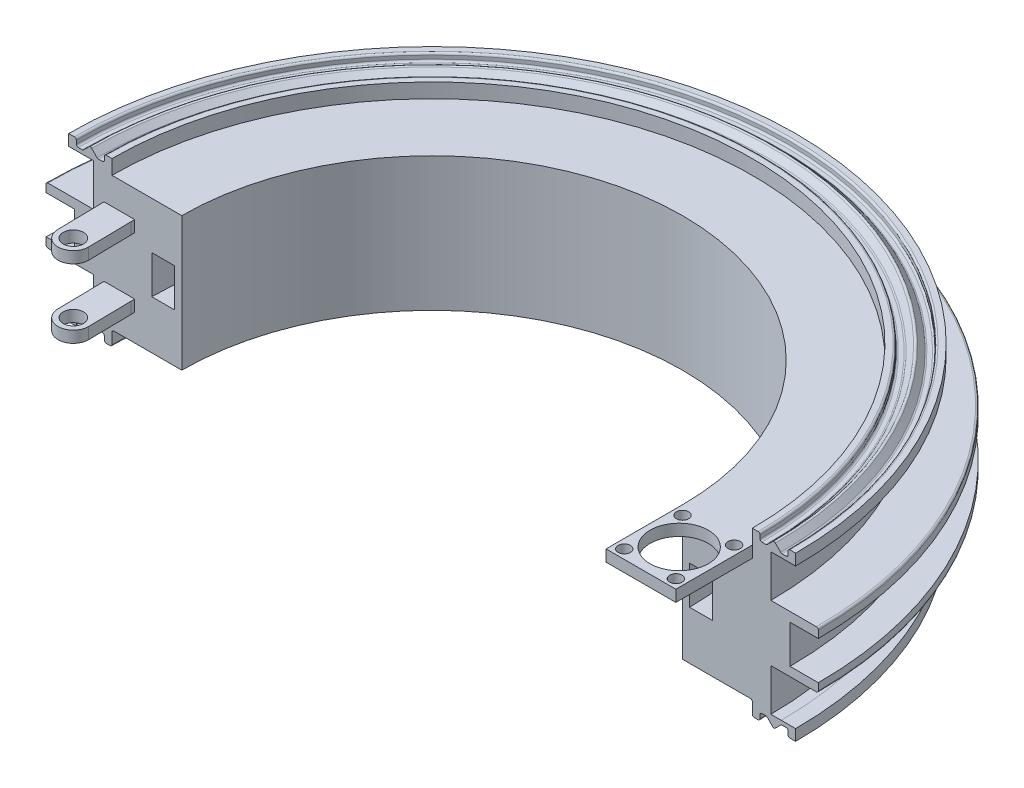
from build123d import *

# Parameters (mm, degrees)
SKETCH1_W           = 6
SKETCH1_H           = 10
SKETCH17_W          = 18.25
SKETCH17_H          = 3
BOSS_EXTRUDE5_DEPTH = 20
FILLET1_R           = 0.5
FILLET2_R           = 0.5
FILLET3_R           = 0.5
FILLET4_R           = 0.5
FILLET5_R           = 0.5
FILLET6_R           = 0.5
FILLET7_R           = 0.5
FILLET9_R           = 0.5
FILLET10_R          = 0.5
SKETCH13_W          = 8
SKETCH13_H          = 3
BOSS_EXTRUDE6_DEPTH = 1
SKETCH19_R          = 2.65
BOSS_EXTRUDE7_DEPTH = 3
SKETCH20_R          = 7.61273287
SKETCH20_R_2        = 1.605194104
CUT_EXTRUDE2_DEPTH  = 13


with BuildPart() as part:
    # Sweep3: sweep along a path in Sketch3
    with BuildLine(Plane(origin=(0, 0, 0), x_dir=(1, 0, 0), z_dir=(0, 1, 0))) as sweep3_path:
        ThreePointArc((0, 0), (65.459977148, 65.459977148), (130.919954296, 0))
    # Sketch1 → Sweep3 (sweep)
    with BuildSketch(Plane.XY):
        Polygon((0, 21.243112223), (0, -13.756887777), (-18.25, -13.756887777), (-18.25, -17.565543398), (-20.25, -17.565543398), (-20.25, -15.656355089), (-22, -15.656355089), (-23.909188309, -17.565543398), (-25.818376618, -15.656355089), (-27.568376618, -15.656355089), (-27.568376618, -17.565543398), (-29.568376618, -17.565543398), (-29.568376618, -14.656355089), (-25.818376618, -14.656355089), (-23.090911996, -14.656355089), (-23.090911996, -3.637682855), (-35.498482324, -3.637682855), (-35.498482324, -1.30053875), (-28.102361975, -1.30053875), (-28.102361975, 8.69946125), (-35.498482324, 8.69946125), (-35.498482324, 11.1239073), (-23.090911996, 11.1239073), (-23.090911996, 22.142579535), (-25.818376618, 22.142579535), (-29.568376618, 22.142579535), (-29.568376618, 25.051767844), (-27.568376618, 25.051767844), (-27.568376618, 23.142579535), (-25.818376618, 23.142579535), (-23.909188309, 25.051767844), (-22, 23.142579535), (-20.25, 23.142579535), (-20.25, 25.051767844), (-18.25, 25.051767844), (-18.25, 21.243112223), align=None)
        with Locations((-4.842428612, 3.950784343)):
            Rectangle(SKETCH1_W, SKETCH1_H, mode=Mode.SUBTRACT)
    sweep(path=sweep3_path.line)

    # Sketch17 → Boss-Extrude5 (add)
    with BuildSketch(Plane.XY):
        with Locations((140.044954296, 19.743112223)):
            Rectangle(SKETCH17_W, SKETCH17_H)
    extrude(amount=BOSS_EXTRUDE5_DEPTH)

    # Fillet1
    fillet1_edges = [part.edges().sort_by_distance(p)[0] for p in [
        (65.459977148, 25.051767844, -89.369165457),
    ]]
    fillet(fillet1_edges, radius=FILLET1_R)

    # Fillet2
    fillet2_edges = [part.edges().sort_by_distance(p)[0] for p in [
        (65.459977148, 23.142579535, -91.278353766),
    ]]
    fillet(fillet2_edges, radius=FILLET2_R)

    # Fillet3
    fillet3_edges = [part.edges().sort_by_distance(p)[0] for p in [
        (65.459977148, 23.142579535, -93.028353766),
    ]]
    fillet(fillet3_edges, radius=FILLET3_R)

    # Fillet4
    fillet4_edges = [part.edges().sort_by_distance(p)[0] for p in [
        (65.459977148, 23.142579535, -85.709977148),
        (65.459977148, 23.142579535, -87.459977148),
    ]]
    fillet(fillet4_edges, radius=FILLET4_R)

    # Fillet5
    fillet5_edges = [part.edges().sort_by_distance(p)[0] for p in [
        (65.459977148, -17.565543398, -85.709977148),
        (65.459977148, -15.656355089, -87.459977148),
        (65.459977148, -17.565543398, -89.369165457),
    ]]
    fillet(fillet5_edges, radius=FILLET5_R)

    # Fillet6
    fillet6_edges = [part.edges().sort_by_distance(p)[0] for p in [
        (65.459977148, -13.756887777, -83.709977148),
        (65.459977148, -17.565543398, -83.709977148),
        (65.459977148, -15.656355089, -85.709977148),
    ]]
    fillet(fillet6_edges, radius=FILLET6_R)

    # Fillet7
    fillet7_edges = [part.edges().sort_by_distance(p)[0] for p in [
        (65.459977148, -15.656355089, -91.278353766),
        (65.459977148, -17.565543398, -93.028353766),
        (65.459977148, -15.656355089, -93.028353766),
    ]]
    fillet(fillet7_edges, radius=FILLET7_R)

    # Fillet9
    fillet9_edges = [part.edges().sort_by_distance(p)[0] for p in [
        (65.459977148, -3.637682855, -100.958459472),
        (65.459977148, 11.1239073, -100.958459472),
    ]]
    fillet(fillet9_edges, radius=FILLET9_R)

    # Fillet10
    fillet10_edges = [part.edges().sort_by_distance(p)[0] for p in [
        (65.459977148, 25.051767844, -93.028353766),
        (65.459977148, 25.051767844, -85.709977148),
    ]]
    fillet(fillet10_edges, radius=FILLET10_R)

    # Sketch13 → Boss-Extrude6 (add)
    with BuildSketch(Plane.XY):
        with Locations((-16.305127065, -5.30053875)):
            Rectangle(SKETCH13_W, SKETCH13_H)
        with Locations((-16.305127065, 12.69946125)):
            Rectangle(SKETCH13_W, SKETCH13_H)
    boss_extrude6 = extrude(amount=BOSS_EXTRUDE6_DEPTH)

    # Sketch19 → Boss-Extrude7 (add)
    with BuildSketch(Plane(origin=(0, 14.19946125, 0), x_dir=(1, 0, 0), z_dir=(0, 1, 0))):
        with BuildLine():
            Line((-12.305127065, -1), (-20.305127065, -1))
            Line((-20.305127065, -1), (-20.115344974, -12.237624493))
            ThreePointArc((-20.115344974, -12.237624493), (-16.115344974, -16.237624493), (-12.115344974, -12.237624493))
            Line((-12.115344974, -12.237624493), (-12.305127065, -1))
        make_face()
        with Locations((-16.115344974, -12.237624493)):
            Circle(SKETCH19_R, mode=Mode.SUBTRACT)
    boss_extrude7 = extrude(amount=-BOSS_EXTRUDE7_DEPTH)

    # Mirror1: Boss-Extrude6, Boss-Extrude7 across plane
    add(boss_extrude6.mirror(Plane.ZX.offset(3.69946125)))
    add(boss_extrude7.mirror(Plane.ZX.offset(3.69946125)))

    # Sketch20 → Cut-Extrude2 (cut)
    with BuildSketch(Plane.XZ.offset(-18.243112223)):
        with Locations((140.044954296, 10)):
            Circle(SKETCH20_R)
        with Locations((133.302123544, 2.38726713)):
            Circle(SKETCH20_R_2)
        with Locations((133.302123544, 17.61273287)):
            Circle(SKETCH20_R_2)
        with Locations((146.787785047, 17.61273287)):
            Circle(SKETCH20_R_2)
        with Locations((146.787785047, 2.38726713)):
            Circle(SKETCH20_R_2)
    extrude(amount=-CUT_EXTRUDE2_DEPTH, mode=Mode.SUBTRACT)


solid = part.part
